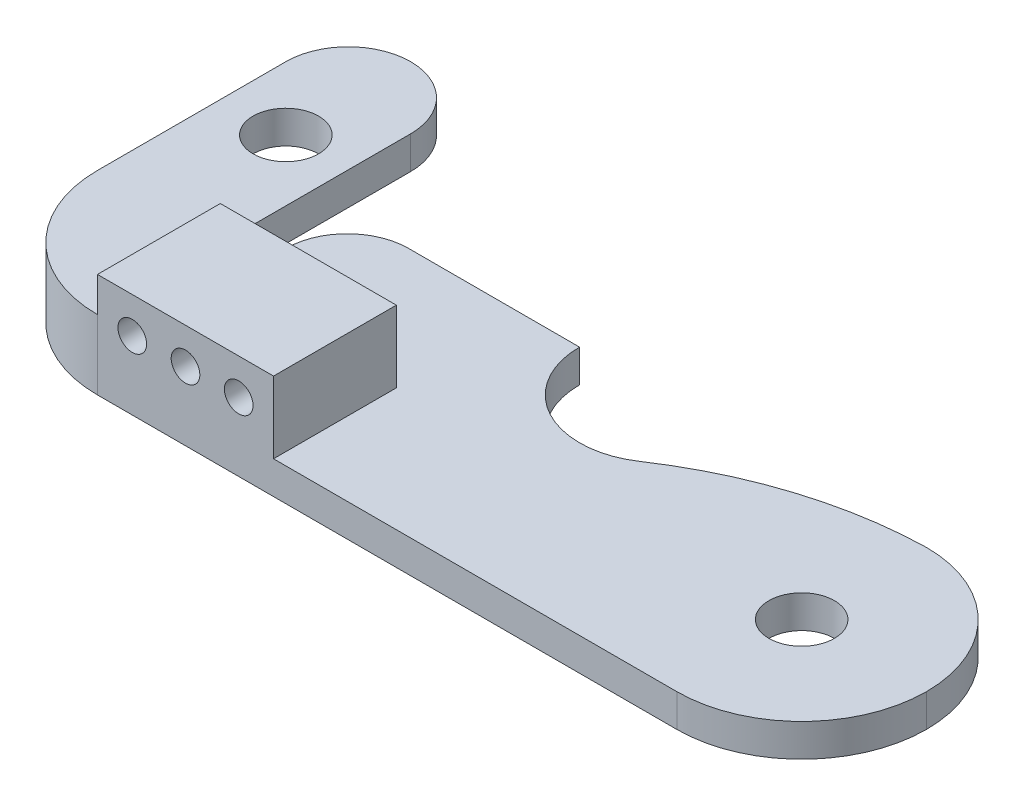
from build123d import *

# Parameters (mm, degrees)
SKETCH1_W           = 34.4
SKETCH1_H           = 12.2
BOSS_EXTRUDE1_DEPTH = 1.6
SKETCH8_R           = 1.6
CUT_EXTRUDE3_DEPTH  = 24.175783188
FILLET2_R           = 3
FILLET3_R           = 6.1
SKETCH2_W           = 8.6
SKETCH2_H           = 6
BOSS_EXTRUDE2_DEPTH = 3.5
SKETCH3_R           = 0.7
CUT_EXTRUDE1_DEPTH  = 6
BOSS_EXTRUDE3_DEPTH = 3.4
SKETCH5_W           = 6.1
SKETCH5_H           = 1.6
BOSS_EXTRUDE4_DEPTH = 9.2
BOSS_EXTRUDE5_DEPTH = 1.6
SKETCH7_R           = 1.6
CUT_EXTRUDE2_DEPTH  = 1.6
FILLET1_R           = 20


# Some blends are built 0.0001 mm under size
with BuildPart() as part:
    # Sketch1 → Boss-Extrude1 (new body)
    with BuildSketch(Plane(origin=(0, 0, 0), x_dir=(1, 0, 0), z_dir=(0, 1, 0))):
        with Locations((3.513069909, 4.172568389)):
            Rectangle(SKETCH1_W, SKETCH1_H)
    extrude(amount=BOSS_EXTRUDE1_DEPTH)

    # Sketch8 → Cut-Extrude3 (cut, through all)
    with BuildSketch(Plane(origin=(0, 1.6, 0), x_dir=(1, 0, 0), z_dir=(0, 1, 0))):
        with Locations(Location((14.613069909, 4.172568389, 0), (0, 0, 270))):
            Circle(SKETCH8_R)
        with BuildLine():
            Line((5.763069909, 10.272568389), (-2.336930091, 10.272568389))
            ThreePointArc((-2.336930091, 10.272568389), (1.713069909, 6.222568389), (5.763069909, 10.272568389))
        make_face()
    extrude(amount=-CUT_EXTRUDE3_DEPTH, mode=Mode.SUBTRACT)

    # Fillet2
    fillet2_edges = [part.edges().sort_by_distance(p)[0] for p in [
        (-13.686930091, 0.8, -10.272568389),
    ]]
    fillet(fillet2_edges, radius=FILLET2_R)

    # Fillet3
    fillet3_edges = [part.edges().sort_by_distance(p)[0] for p in [
        (20.713069909, 0.8, 1.927431611),
        (20.713069909, 0.8, -10.272568389),
    ]]
    fillet(fillet3_edges, radius=FILLET3_R - 0.0001)  # a hair under: the kernel refuses the full size

    # Sketch2 → Boss-Extrude2 (add)
    with BuildSketch(Plane(origin=(0, 1.6, 0), x_dir=(1, 0, 0), z_dir=(0, 1, 0))):
        with Locations((-9.386930091, 1.072568389)):
            Rectangle(SKETCH2_W, SKETCH2_H)
    extrude(amount=BOSS_EXTRUDE2_DEPTH)

    # Sketch3 → Cut-Extrude1 (cut)
    with BuildSketch(Plane.XY.offset(1.927431611)):
        with Locations((-11.986930091, 3.35)):
            Circle(SKETCH3_R)
        with Locations((-6.786930091, 3.35)):
            Circle(SKETCH3_R)
        with Locations((-9.386930091, 3.35)):
            Circle(SKETCH3_R)
    extrude(amount=-CUT_EXTRUDE1_DEPTH, mode=Mode.SUBTRACT)



with BuildPart() as body_2:
    # Sketch4 → Boss-Extrude3 (new body)
    with BuildSketch(Plane.XZ):
        with BuildLine():
            Line((-13.686930091, 1.927431611), (-13.686930091, -4.172568389))
            Line((-13.686930091, -4.172568389), (-19.786930091, -4.172568389))
            ThreePointArc((-19.786930091, -4.172568389), (-18.000281456, 0.140782976), (-13.686930091, 1.927431611))
        make_face()
    extrude(amount=-BOSS_EXTRUDE3_DEPTH)


with BuildPart() as part_1:
    add(part.part)

    add(body_2.part)  # Boss-Extrude4 merges body 2
    # Sketch5 → Boss-Extrude4 (add)
    with BuildSketch(Plane(origin=(0, 0, -4.172568389), x_dir=(-1, 0, 0), z_dir=(0, 0, -1))):
        with Locations((16.736930091, 2.6)):
            Rectangle(SKETCH5_W, SKETCH5_H)
    extrude(amount=BOSS_EXTRUDE4_DEPTH)

    # Sketch6 → Boss-Extrude5 (add)
    with BuildSketch(Plane(origin=(0, 3.4, 0), x_dir=(1, 0, 0), z_dir=(0, 1, 0))):
        with BuildLine():
            Line((-19.786930091, 13.372568389), (-13.686930091, 13.372568389))
            ThreePointArc((-13.686930091, 13.372568389), (-16.736930091, 16.422568389), (-19.786930091, 13.372568389))
        make_face()
    extrude(amount=-BOSS_EXTRUDE5_DEPTH)

    # Sketch7 → Cut-Extrude2 (cut)
    with BuildSketch(Plane(origin=(0, 3.4, 0), x_dir=(1, 0, 0), z_dir=(0, 1, 0))):
        with Locations(Location((-16.686930091, 10.272568389, 0), (0, 0, 270))):
            Circle(SKETCH7_R)
    extrude(amount=-CUT_EXTRUDE2_DEPTH, mode=Mode.SUBTRACT)

    # Fillet1
    # the kernel refuses this fillet: 20 mm, written as the material it takes off along each edge
    with BuildSketch(Plane(origin=(5.763069909, 23.72525, -10.272568389), x_dir=(-0.47132268480502076, 0, 0.8819608419811998), z_dir=(0, -1, 0))) as fillet1_piece_1:
        with BuildLine():
            CenterArc((13.244167443, -17.63921684), FILLET1_R, 118.12018917, 32.428171428)
            Line((-4.171252893, -7.805441648), (-4.5195613, -7.608766144))
            ThreePointArc((-4.5195613, -7.608766144), (-2.438410783, -3.71419175), (-0.352784337, 0.188529074))
            Line((-0.352784337, 0.188529074), (0.188529074, 0.352784337))
            ThreePointArc((0.188529074, 0.352784337), (1.908856873, -0.07805859), (3.629184673, 0.352784337))
            Line((3.629184673, 0.352784337), (3.817713747, 0))
        make_face()
    extrude(amount=45.8505, mode=Mode.SUBTRACT)


solid = part_1.part
